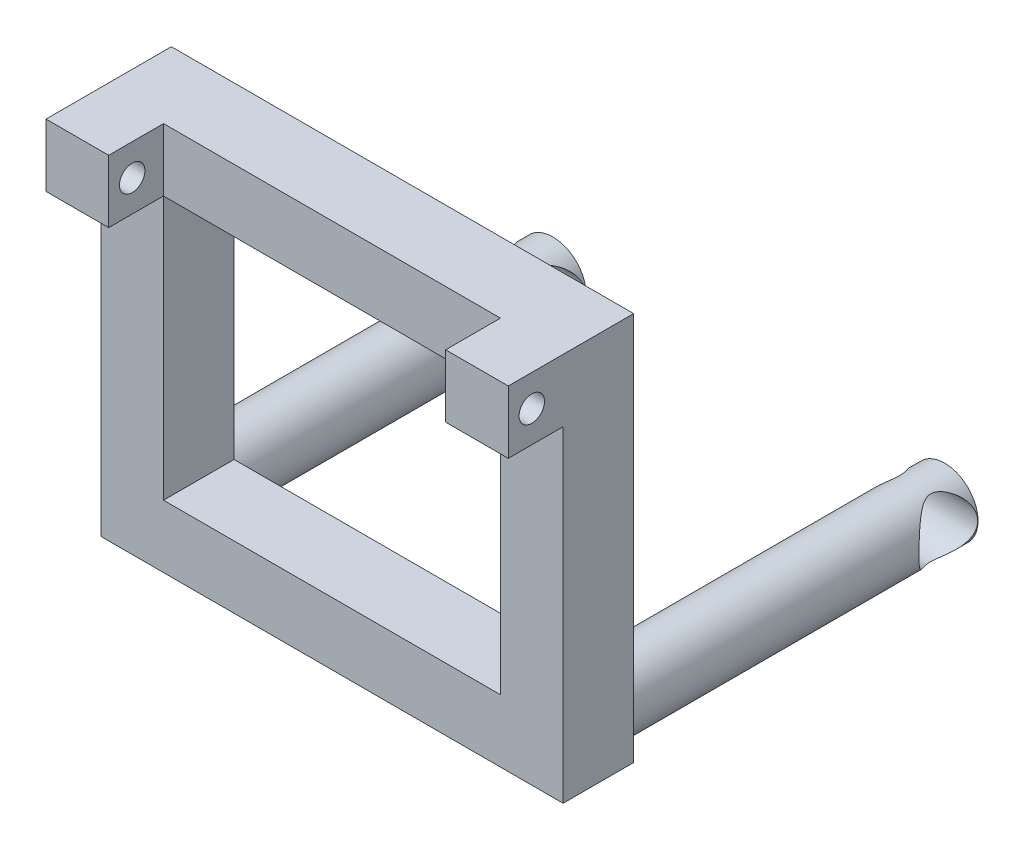
from build123d import *

# Parameters (mm, degrees)
SKETCH1_W           = 1180.071112
SKETCH1_H           = 992.574724554
SKETCH1_W_2         = 860.071112
SKETCH1_H_2         = 672.574724554
BOSS_EXTRUDE2_DEPTH = 180
SKETCH2_W           = 160
SKETCH2_H           = 160
BOSS_EXTRUDE3_DEPTH = 140
SKETCH4_R           = 85
BOSS_EXTRUDE4_DEPTH = 884
SKETCH5_R           = 75
CUT_EXTRUDE2_DEPTH  = 1704.724945294
SKETCH6_R           = 32.5
CUT_EXTRUDE3_DEPTH  = 1697.754922537


with BuildPart() as part:
    # Sketch1 → Boss-Extrude2 (new body)
    with BuildSketch(Plane.XY):
        with Locations((-366.347627568, -343.327690947)):
            Rectangle(SKETCH1_W, SKETCH1_H)
        with Locations((-366.347627568, -343.327690947)):
            Rectangle(SKETCH1_W_2, SKETCH1_H_2, mode=Mode.SUBTRACT)
    extrude(amount=BOSS_EXTRUDE2_DEPTH)

    # Sketch2 → Boss-Extrude3 (add)
    with BuildSketch(Plane.XY.offset(180)):
        with Locations((-876.383183568, 72.95967133)):
            Rectangle(SKETCH2_W, SKETCH2_H)
        with Locations((143.687928432, 72.95967133)):
            Rectangle(SKETCH2_W, SKETCH2_H)
    extrude(amount=BOSS_EXTRUDE3_DEPTH)

    # Sketch4 → Boss-Extrude4 (add)
    with BuildSketch(Plane(origin=(0, 0, 0), x_dir=(-1, 0, 0), z_dir=(0, 0, -1))):
        with Locations((-133.687928432, -749.615053224)):
            Circle(SKETCH4_R)
        with Locations((866.383183568, -749.615053224)):
            Circle(SKETCH4_R)
    extrude(amount=BOSS_EXTRUDE4_DEPTH)

    # Sketch5 → Cut-Extrude2 (cut, through all)
    with BuildSketch(Plane(origin=(233.687928432, 0, 0), x_dir=(0, 0, -1), z_dir=(1, 0, 0))):
        with Locations((808.343239866, -749.615053224)):
            Circle(SKETCH5_R)
    extrude(amount=-CUT_EXTRUDE2_DEPTH, mode=Mode.SUBTRACT)

    # Sketch6 → Cut-Extrude3 (cut, through all)
    with BuildSketch(Plane(origin=(223.687928432, 0, 0), x_dir=(0, 0, -1), z_dir=(1, 0, 0))):
        with Locations((-260, 72.95967133)):
            Circle(SKETCH6_R)
    extrude(amount=-CUT_EXTRUDE3_DEPTH, mode=Mode.SUBTRACT)


solid = part.part
